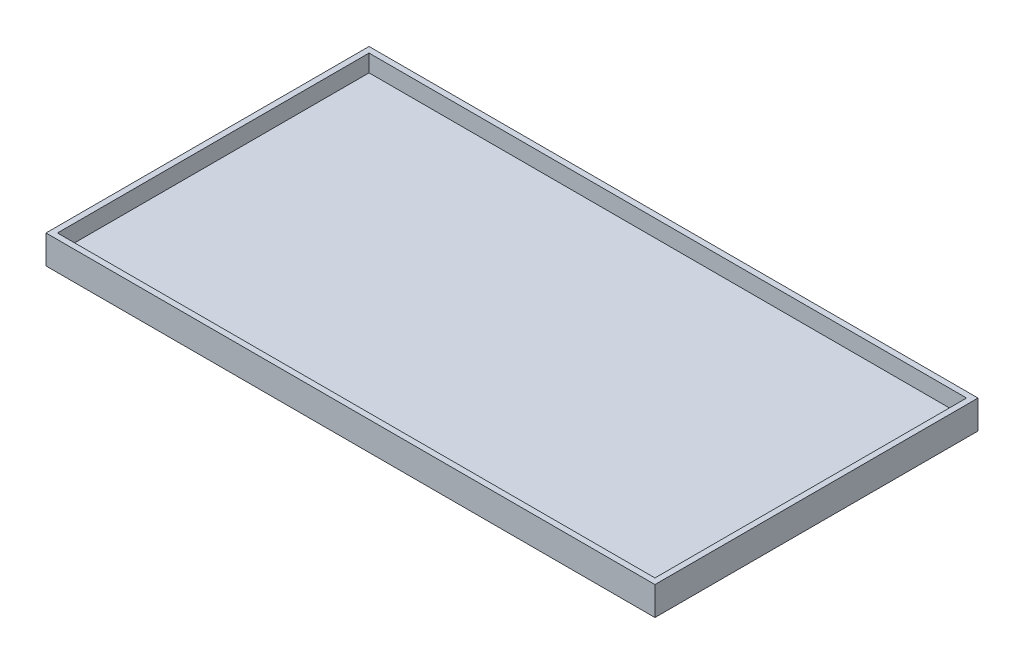
from build123d import *

# Parameters (mm, degrees)
SKETCH1_W           = 106.5
SKETCH1_H           = 56.5
SKETCH1_W_2         = 104.5
SKETCH1_H_2         = 54.5
BOSS_EXTRUDE1_DEPTH = 5
SKETCH2_W           = 106.5
SKETCH2_H           = 56.5
BOSS_EXTRUDE2_DEPTH = 2


with BuildPart() as part:
    # Sketch1 → Boss-Extrude1 (new body)
    with BuildSketch(Plane(origin=(0, 0, 0), x_dir=(1, 0, 0), z_dir=(0, 1, 0))):
        Rectangle(SKETCH1_W, SKETCH1_H)
        Rectangle(SKETCH1_W_2, SKETCH1_H_2, mode=Mode.SUBTRACT)
    extrude(amount=BOSS_EXTRUDE1_DEPTH)

    # Sketch2 → Boss-Extrude2 (add)
    with BuildSketch(Plane(origin=(0, 0, 0), x_dir=(1, 0, 0), z_dir=(0, 1, 0))):
        Rectangle(SKETCH2_W, SKETCH2_H)
    extrude(amount=BOSS_EXTRUDE2_DEPTH)


solid = part.part
